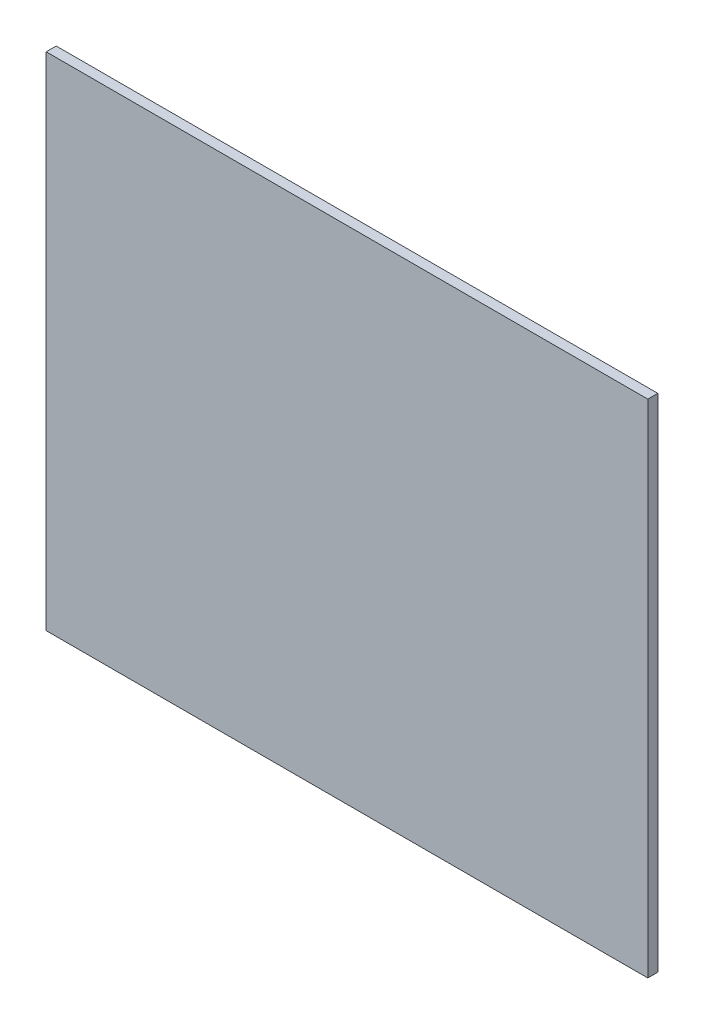
from build123d import *

# Parameters (mm, degrees)
ESQUISSE1_W        = 600
ESQUISSE1_H        = 500
BOSS_EXTRU_1_DEPTH = 10


with BuildPart() as part:
    # Esquisse1 → Boss.-Extru.1 (new body)
    with BuildSketch(Plane.XY):
        with Locations((300, 250)):
            Rectangle(ESQUISSE1_W, ESQUISSE1_H)
    extrude(amount=BOSS_EXTRU_1_DEPTH)


solid = part.part
